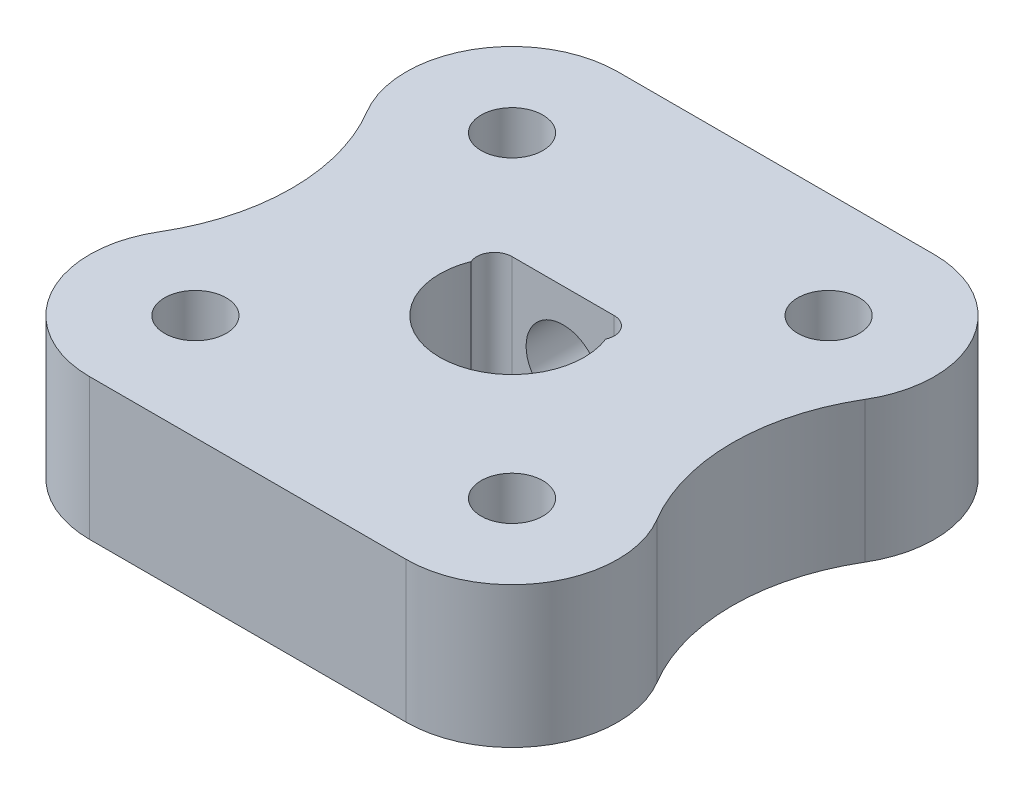
from build123d import *

# Parameters (mm, degrees)
SKETCH1_R                 = 0.875
BASE_SHAPE_DEPTH          = 4
M2_5_GRUB_SCREW_CUT_REACH = 19.219
SKETCH3_R                 = 1.05


with BuildPart() as part:
    # Sketch1 → Base shape (new body)
    with BuildSketch(Plane(origin=(0, 0, 0), x_dir=(1, 0, 0), z_dir=(0, 1, 0))):
        with BuildLine():
            Line((4.490128061, 7.490128061), (-4.490128061, 7.490128061))
            ThreePointArc((-4.490128061, 7.490128061), (-7.099636787, 5.970149752), (-7.064881074, 2.950437533))
            ThreePointArc((-7.064881074, 2.950437533), (-6.25, 0), (-7.064881074, -2.950437533))
            ThreePointArc((-7.064881074, -2.950437533), (-7.099636787, -5.970149752), (-4.490128061, -7.490128061))
            Line((-4.490128061, -7.490128061), (4.490128061, -7.490128061))
            ThreePointArc((4.490128061, -7.490128061), (7.099636787, -5.970149752), (7.064881074, -2.950437533))
            ThreePointArc((7.064881074, -2.950437533), (6.25, 0), (7.064881074, 2.950437533))
            ThreePointArc((7.064881074, 2.950437533), (7.099636787, 5.970149752), (4.490128061, 7.490128061))
        make_face()
        with BuildLine():
            Line((-1.449137675, 1.45), (1.449137675, 1.45))
            ThreePointArc((1.449137675, 1.45), (1.867293493, 1.224127182), (1.907649179, 0.750582848))
            ThreePointArc((1.907649179, 0.750582848), (0, -2.05), (-1.907649179, 0.750582848))
            ThreePointArc((-1.907649179, 0.750582848), (-1.867293493, 1.224127182), (-1.449137675, 1.45))
        make_face(mode=Mode.SUBTRACT)
        with Locations((4.490128061, 4.490128061)):
            Circle(SKETCH1_R, mode=Mode.SUBTRACT)
        with Locations((4.490128061, -4.490128061)):
            Circle(SKETCH1_R, mode=Mode.SUBTRACT)
        with Locations((-4.490128061, -4.490128061)):
            Circle(SKETCH1_R, mode=Mode.SUBTRACT)
        with Locations((-4.490128061, 4.490128061)):
            Circle(SKETCH1_R, mode=Mode.SUBTRACT)
    extrude(amount=BASE_SHAPE_DEPTH)

    # Sketch3 → M2.5 Grub screw cut (cut, up to next)
    with BuildSketch(Plane.XY.offset(-7.490128061), mode=Mode.PRIVATE) as m2_5_grub_screw_cut_sk1:
        with Locations((0, 2)):
            Circle(SKETCH3_R)
    m2_5_grub_screw_cut_tool1 = extrude(m2_5_grub_screw_cut_sk1.sketch, amount=M2_5_GRUB_SCREW_CUT_REACH, mode=Mode.PRIVATE) & part.part
    add(m2_5_grub_screw_cut_tool1.solids().sort_by_distance((0, 2, -7.490128))[0], mode=Mode.SUBTRACT)


solid = part.part
